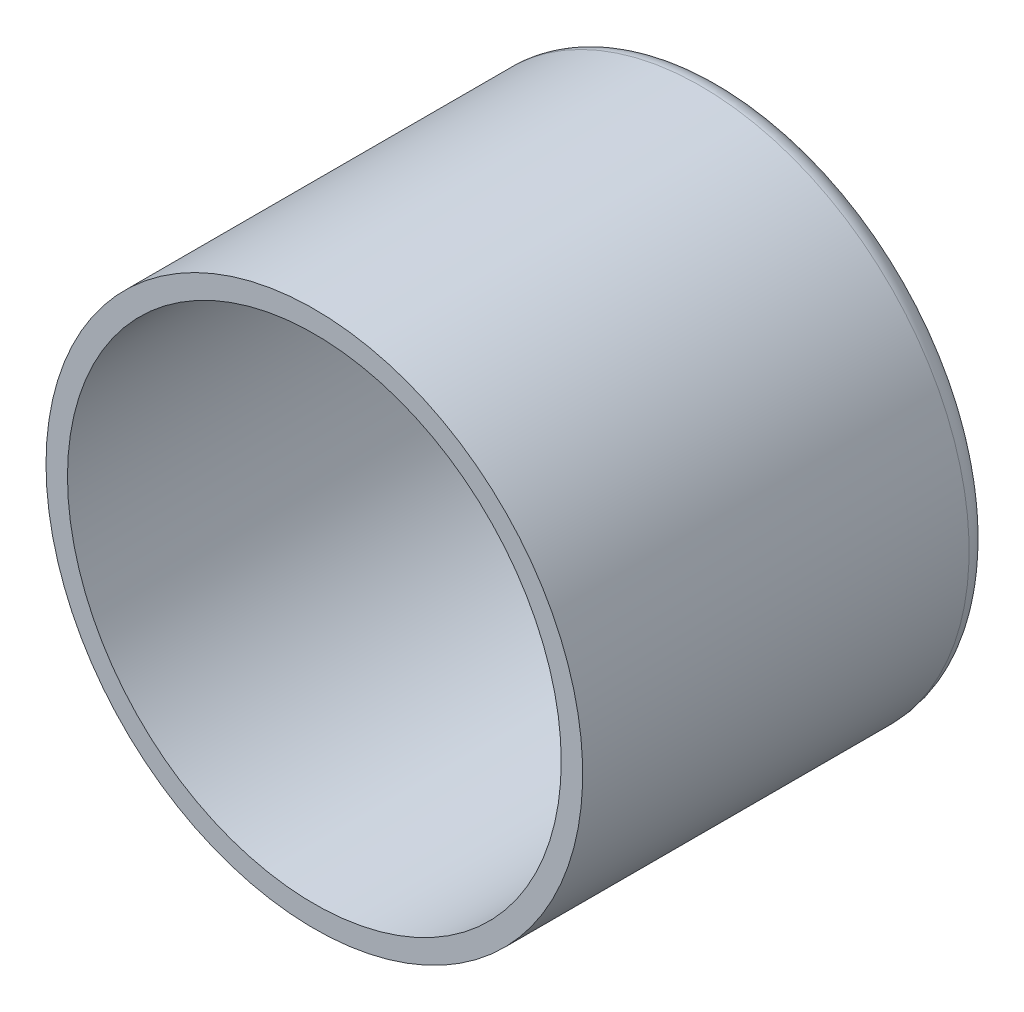
from build123d import *

# Parameters (mm, degrees)
SKETCH_1_R          = 25
SKETCH_1_R_2        = 23
EXTRUDE_1_DEPTH     = 40
EXTRUDE_START       = 2
SKETCH_2_R          = 25
EXTRUDE_2_DEPTH     = 2
SKETCH_3_R          = 16.5
CUT_EXTRUDE_1_DEPTH = 2
FILLET_1_R          = 2
FILLET_2_R          = 2
FILLET_3_R          = 2
SKETCH_4_W          = 61.708706265
SKETCH_4_H          = 81.66323808
CUT_EXTRUDE_2_DEPTH = 4


with BuildPart() as part:
    # 草图1 → 凸台-拉伸1 (new body)
    with BuildSketch(Plane.XY):
        Circle(SKETCH_1_R)
        Circle(SKETCH_1_R_2, mode=Mode.SUBTRACT)
    extrude(amount=EXTRUDE_1_DEPTH)

    # 草图2 → 凸台-拉伸2 (add)
    with BuildSketch(Plane(origin=(0, 0, 0), x_dir=(-1, 0, 0), z_dir=(0, 0, -1)).offset(EXTRUDE_START)):
        Circle(SKETCH_2_R)
    extrude(amount=-EXTRUDE_2_DEPTH)

    # 草图3 → 切除-拉伸1 (cut)
    with BuildSketch(Plane(origin=(0, 0, -2), x_dir=(-1, 0, 0), z_dir=(0, 0, -1))):
        Circle(SKETCH_3_R)
    extrude(amount=-CUT_EXTRUDE_1_DEPTH, mode=Mode.SUBTRACT)

    # 圆角1
    fillet_1_edges = [part.edges().sort_by_distance(p)[0] for p in [
        (25, 0, -2),
    ]]
    fillet(fillet_1_edges, radius=FILLET_1_R - 0.0001)  # a hair under: the kernel refuses the full size

    # 圆角2
    fillet_2_edges = [part.edges().sort_by_distance(p)[0] for p in [
        (-23, 0, 0),
    ]]
    fillet(fillet_2_edges, radius=FILLET_2_R)

    # 圆角3
    fillet_3_edges = [part.edges().sort_by_distance(p)[0] for p in [
        (16.5, 0, -2),
    ]]
    fillet(fillet_3_edges, radius=FILLET_3_R - 0.0001)  # a hair under: the kernel refuses the full size

    # 草图4 → 切除-拉伸2 (cut)
    with BuildSketch(Plane.XY.offset(40)):
        with Locations((-0.068337437, -3.724390356)):
            Rectangle(SKETCH_4_W, SKETCH_4_H)
    extrude(amount=-CUT_EXTRUDE_2_DEPTH, mode=Mode.SUBTRACT)


solid = part.part
